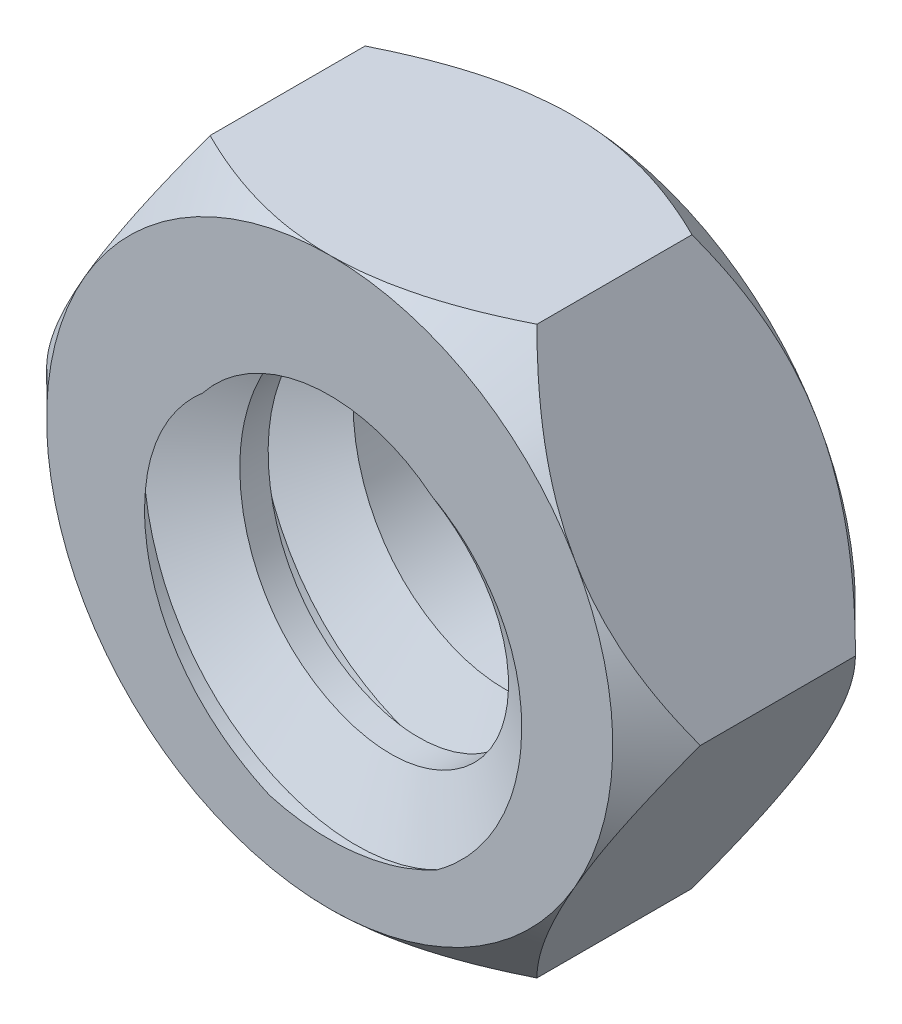
from build123d import *

# Parameters (mm, degrees)
BOSS_EXTRUDE1_DEPTH = 1.5
CUT_EXTRUDE1_REACH  = 5.065
SKETCH1_3_R         = 1
SKETCH1_4_OUTSIDE_W = 9.152
SKETCH1_4_OUTSIDE_H = 8.61
SKETCH1_4_OUTSIDE_R = 1.75
CUT_EXTRUDE2_DEPTH  = 1
CUT_EXTRUDE2_DRAFT  = 45
SKETCH2_OUTSIDE_W   = 9.152
SKETCH2_OUTSIDE_H   = 8.61
SKETCH2_OUTSIDE_R   = 1.75
CUT_EXTRUDE3_DEPTH  = 1
CUT_EXTRUDE3_DRAFT  = -45
THREAD1_PITCH       = 0.7


with BuildPart() as part:
    # Sketch1 → Boss-Extrude1 (new body)
    with BuildSketch(Plane.XY):
        Polygon((2.020725942, 0), (1.010362971, 1.75), (-1.010362971, 1.75), (-2.020725942, 0), (-1.010362971, -1.75), (1.010362971, -1.75), align=None)
    extrude(amount=BOSS_EXTRUDE1_DEPTH)

    # Sketch1<3> → Cut-Extrude1 (cut, up to next)
    with BuildSketch(Plane.XY, mode=Mode.PRIVATE) as cut_extrude1_sk1:
        Circle(SKETCH1_3_R)
    cut_extrude1_tool1 = extrude(cut_extrude1_sk1.sketch, amount=CUT_EXTRUDE1_REACH, mode=Mode.PRIVATE) & part.part
    add(cut_extrude1_tool1.solids().sort_by_distance((0, 0, 0))[0], mode=Mode.SUBTRACT)


with BuildPart() as cut_extrude2_tool:
    # Sketch1<4> outside → Cut-Extrude2 (with draft: the straight prism first)
    with BuildSketch(Plane.XY):
        Rectangle(SKETCH1_4_OUTSIDE_W, SKETCH1_4_OUTSIDE_H)
        Circle(SKETCH1_4_OUTSIDE_R, mode=Mode.SUBTRACT)
    extrude(amount=CUT_EXTRUDE2_DEPTH)
    # Cut-Extrude2: the draft: its side faces are tilted about the plane it starts from
    cut_extrude2_sides = [cut_extrude2_tool.faces().sort_by_distance(p)[0] for p in [
        (0, -4.305, 0.5),
        (4.576, 0, 0.5),
        (0, 4.305, 0.5),
        (-4.576, 0, 0.5),
        (-1.75, 0, 0.5),
    ]]
    draft(cut_extrude2_sides, Plane.XY, CUT_EXTRUDE2_DRAFT)


with BuildPart() as part_1:
    add(part.part)

    # Cut-Extrude2: cut by cut_extrude2_tool
    add(cut_extrude2_tool.part, mode=Mode.SUBTRACT)


with BuildPart() as cut_extrude3_tool:
    # Sketch2 outside → Cut-Extrude3 (with draft: the straight prism first)
    with BuildSketch(Plane.XY.offset(1.5)):
        Rectangle(SKETCH2_OUTSIDE_W, SKETCH2_OUTSIDE_H)
        Circle(SKETCH2_OUTSIDE_R, mode=Mode.SUBTRACT)
    extrude(amount=-CUT_EXTRUDE3_DEPTH)
    # Cut-Extrude3: the draft: its side faces are tilted about the plane it starts from
    cut_extrude3_sides = [cut_extrude3_tool.faces().sort_by_distance(p)[0] for p in [
        (0, -4.305, 1),
        (4.576, 0, 1),
        (0, 4.305, 1),
        (-4.576, 0, 1),
        (-1.75, 0, 1),
    ]]
    draft(cut_extrude3_sides, Plane.XY.offset(1.5), CUT_EXTRUDE3_DRAFT)


with BuildPart() as part_2:
    add(part_1.part)

    # Cut-Extrude3: cut by cut_extrude3_tool
    add(cut_extrude3_tool.part, mode=Mode.SUBTRACT)

    # Thread1: the profile of Thread Profile1 profile screwed along a right-hand helix of 2.142857 turns, 6 arcs to a turn; built about Z, then put on its axis
    thread1_z = Axis((0, 0, 0), (0, 0, 1))
    thread1_corners = [(0.9997, 0, -0.000173205), (1.378886113, 0, 0.218749999), (1.378886113, 0, 0.306249999), (0.9997, 0, 0.525173203)]
    with BuildLine(mode=Mode.PRIVATE) as thread1_profile:
        Line(thread1_corners[0], thread1_corners[1])
        Line(thread1_corners[1], thread1_corners[2])
        Line(thread1_corners[2], thread1_corners[3])
        Line(thread1_corners[3], thread1_corners[0])
    thread1_cap = Face(thread1_profile.wire())
    thread1_turn_angles = [0, 30, 60, 90, 120, 150, 180, 210, 240, 270, 300, 330, 360]
    thread1_turn_weights = [1, 0.8660254037844387, 1, 0.8660254037844387, 1, 0.8660254037844387, 1, 0.8660254037844387, 1, 0.8660254037844387, 1, 0.8660254037844387, 1]
    thread1_turn_rails = [Edge.make_bspline([Vector(p[0], p[1], 0).rotate(thread1_z, thread1_turn_angles[k]) / thread1_turn_weights[k] + Vector(0, 0, p[2] + THREAD1_PITCH * thread1_turn_angles[k] / 360) for k in range(13)], [0, 0, 0, 1, 1, 2, 2, 3, 3, 4, 4, 5, 5, 6, 6, 6], 2, thread1_turn_weights) for p in thread1_corners]
    thread1_turn_sides = [Face.make_surface_from_curves(thread1_turn_rails[p[0]], thread1_turn_rails[p[1]]) for p in [(0, 1), (1, 2), (2, 3), (3, 0)]]
    thread1_last_angles = [720, 745.714285714, 771.428571429]
    thread1_last_weights = [1, 0.900968867902419, 1]
    thread1_last_rails = [Edge.make_bspline([Vector(p[0], p[1], 0).rotate(thread1_z, thread1_last_angles[k]) / thread1_last_weights[k] + Vector(0, 0, p[2] + THREAD1_PITCH * thread1_last_angles[k] / 360) for k in range(3)], [0, 0, 0, 1, 1, 1], 2, thread1_last_weights) for p in thread1_corners]
    thread1_last_sides = [Face.make_surface_from_curves(thread1_last_rails[p[0]], thread1_last_rails[p[1]]) for p in [(0, 1), (1, 2), (2, 3), (3, 0)]]
    thread1 = Plane(origin=(0, 0, 0), x_dir=(1, 0, 0), z_dir=(0, 0, 1)) * Solid(Shell([*[p.moved(Location((0, 0, THREAD1_PITCH * i))) for i in range(2) for p in thread1_turn_sides], *thread1_last_sides, thread1_cap, thread1_cap.rotate(thread1_z, 771.428571429).moved(Location((0, 0, THREAD1_PITCH * 771.428571429 / 360)))]))
    add(thread1, mode=Mode.SUBTRACT)


solid = part_2.part
